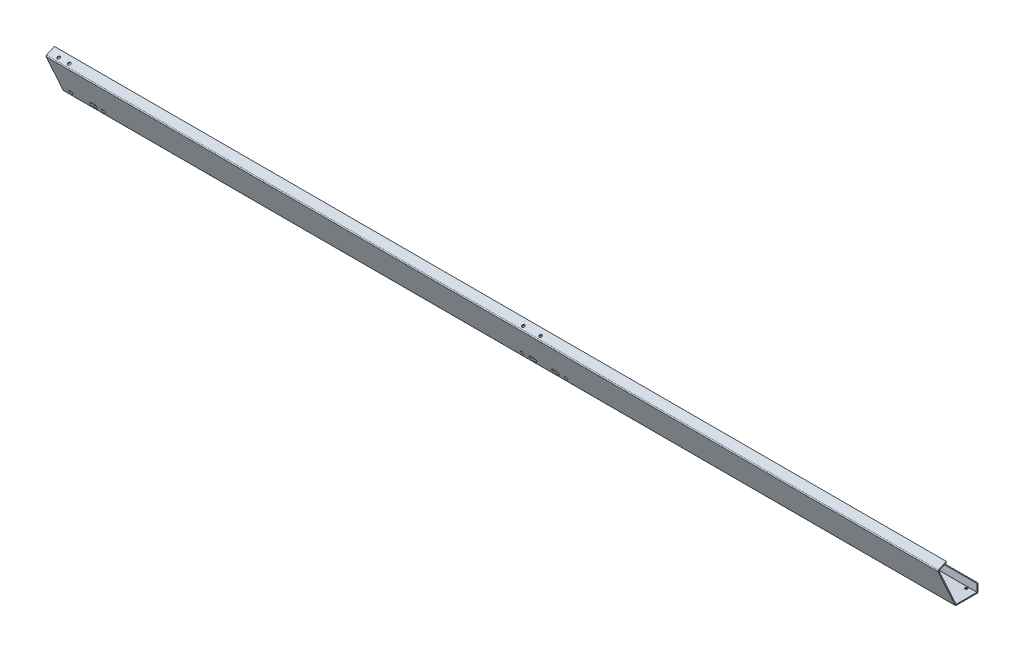
from build123d import *

# Parameters (mm, degrees)
SKETCH1_W                    = 4665
SKETCH1_H                    = 45
BASE_FLANGE1_DEPTH           = 5
EDGE_FLANGE1_STRIP_W         = 20.4
EDGE_FLANGE1_STRIP_H         = 5
EDGE_FLANGE1_STRIP_CUT_DEPTH = 4665
EDGE_FLANGE1_DEPTH           = 4665
EDGE_FLANGE2_START           = -2332.5
EDGE_FLANGE2_DEPTH           = 4665
EDGE_FLANGE2_2_DEPTH         = 4665
EDGE_FLANGE3_STRIP_W         = 20.4
EDGE_FLANGE3_STRIP_H         = 5
EDGE_FLANGE3_STRIP_CUT_DEPTH = 4665
EDGE_FLANGE3_DEPTH           = 4665
SKETCH15_R                   = 7
CUT_EXTRUDE1_DEPTH           = 10
SKETCH16_R                   = 7
CUT_EXTRUDE2_DEPTH           = 10
SKETCH17_R                   = 6.5
CUT_EXTRUDE3_DEPTH           = 10
LPATTERN1_COUNT              = 26
LPATTERN1_PITCH              = 178
SKETCH18_R                   = 9
CUT_EXTRUDE4_DEPTH           = 10


# Read off the part's stored shape, not the designer's step: Edge-Flange2
# Sheet-metal steps are written as plain solids
with BuildPart() as part:
    # Sketch1 → Base-Flange1 (new body)
    with BuildSketch(Plane.XY):
        Rectangle(SKETCH1_W, SKETCH1_H)
    extrude(amount=-BASE_FLANGE1_DEPTH)

    # Edge-Flange1 strip (across the edge) → Edge-Flange1 strip cut (cut)
    with BuildSketch(Plane(origin=(-2332.5, -22.5, 0), x_dir=(0, 1, 0), z_dir=(1, 0, 0))):
        with Locations((-5, -2.5)):
            Rectangle(EDGE_FLANGE1_STRIP_W, EDGE_FLANGE1_STRIP_H)
    extrude(amount=EDGE_FLANGE1_STRIP_CUT_DEPTH, mode=Mode.SUBTRACT)

    # Edge-Flange1 section (across the edge) → Edge-Flange1 (add)
    with BuildSketch(Plane(origin=(-2332.5, -22.5, 0), x_dir=(0, 1, 0), z_dir=(1, 0, 0))):
        with BuildLine():
            Line((0, 0.2), (0, 115))
            Line((0, 115), (5, 115))
            Line((5, 115), (5, 0.2))
            ThreePointArc((5, 0.2), (5.058578644, 0.058578644), (5.2, 0))
            Line((5.2, 0), (5.2, -5))
            ThreePointArc((5.2, -5), (1.523044738, -3.476955262), (0, 0.2))
        make_face()
    extrude(amount=EDGE_FLANGE1_DEPTH)

    # Edge-Flange2 outline → Edge-Flange2 (cut)
    with BuildSketch(Plane.YZ.offset(EDGE_FLANGE2_START)):
        with BuildLine():
            ThreePointArc((-22.5, 109.376616329), (-21.673402867, 112.18968358), (-19.456404862, 114.108414938))
            Line((-19.456404862, 114.108414938), (-17.5, 115))
            Line((-17.5, 115), (-22.5, 115))
            Line((-22.5, 115), (-22.5, 109.376616329))
        make_face()
    extrude(amount=EDGE_FLANGE2_DEPTH, mode=Mode.SUBTRACT)

    # Edge-Flange2 2 outline → Edge-Flange2 2 (add)
    with BuildSketch(Plane.YZ.offset(EDGE_FLANGE2_START)):
        with BuildLine():
            Line((182.241285947, 206.02734832), (-17.5, 115))
            Line((-17.5, 115), (-17.5, 109.376616329))
            ThreePointArc((-17.5, 109.376616329), (-17.468207803, 109.484811224), (-17.382938649, 109.558608584))
            Line((-17.382938649, 109.558608584), (184.314752161, 201.477541966))
            Line((184.314752161, 201.477541966), (182.241285947, 206.02734832))
        make_face()
    extrude(amount=EDGE_FLANGE2_2_DEPTH)

    # Edge-Flange3 strip (across the edge) → Edge-Flange3 strip cut (cut)
    with BuildSketch(Plane(origin=(-2332.5, 184.314752161, 201.477541966), x_dir=(0, -0.9099612708765384, -0.4146932426562495), z_dir=(1, 0, 0))):
        with Locations((-5, -2.5)):
            Rectangle(EDGE_FLANGE3_STRIP_W, EDGE_FLANGE3_STRIP_H)
    extrude(amount=EDGE_FLANGE3_STRIP_CUT_DEPTH, mode=Mode.SUBTRACT)

    # Edge-Flange3 section (across the edge) → Edge-Flange3 (add)
    with BuildSketch(Plane(origin=(-2332.5, 184.314752161, 201.477541966), x_dir=(0, -0.9099612708765384, -0.4146932426562495), z_dir=(1, 0, 0))):
        with BuildLine():
            Line((0, 0.2), (0, 45))
            Line((0, 45), (5, 45))
            Line((5, 45), (5, 0.2))
            ThreePointArc((5, 0.2), (5.058578644, 0.058578644), (5.2, 0))
            Line((5.2, 0), (5.2, -5))
            ThreePointArc((5.2, -5), (1.523044738, -3.476955262), (0, 0.2))
        make_face()
    extrude(amount=EDGE_FLANGE3_DEPTH)

    # Sketch15 → Cut-Extrude1 (cut)
    with BuildSketch(Plane(origin=(0, 228.646570306, 104.200245326), x_dir=(1, 0, 0), z_dir=(0, 0.9099612708765382, 0.4146932426562498))):
        with Locations(Location((-2282.5, -91.902677897, 0), (0, 0, 270))):
            Circle(SKETCH15_R)
        with Locations(Location((-2227.5, -91.902677897, 0), (0, 0, 270))):
            Circle(SKETCH15_R)
    extrude(amount=-CUT_EXTRUDE1_DEPTH, mode=Mode.SUBTRACT)

    # Sketch16 → Cut-Extrude2 (cut)
    with BuildSketch(Plane(origin=(0, 228.646570306, 104.200245326), x_dir=(1, 0, 0), z_dir=(0, 0.9099612708765383, 0.41469324265624985))):
        with Locations(Location((237.5, -91.902677897, 0), (0, 0, 270))):
            Circle(SKETCH16_R)
        with Locations(Location((147.5, -91.902677897, 0), (0, 0, 270))):
            Circle(SKETCH16_R)
    extrude(amount=-CUT_EXTRUDE2_DEPTH, mode=Mode.SUBTRACT)

    # Sketch17 → Cut-Extrude3 (cut)
    with BuildSketch(Plane.XZ.offset(22.5)):
        with Locations(Location((-2163.5, 10, 0), (0, 0, 270))):
            Circle(SKETCH17_R)
    cut_extrude3 = extrude(amount=-CUT_EXTRUDE3_DEPTH, mode=Mode.SUBTRACT)

    # LPattern1: Cut-Extrude3 ×26
    with Locations(*[(i * LPATTERN1_PITCH, 0, 0) for i in range(1, LPATTERN1_COUNT)]):
        add(cut_extrude3, mode=Mode.SUBTRACT)

    # Sketch18 → Cut-Extrude4 (cut)
    with BuildSketch(Plane(origin=(0, -46.405284359, 101.827102994), x_dir=(1, 0, 0), z_dir=(0, -0.4146932426562464, 0.90996127087654))):
        with Locations(Location((-2112.5, 52.249514406, 0), (0, 0, 270))):
            Circle(SKETCH18_R)
        with Locations(Location((-2282.5, 52.249514406, 0), (0, 0, 270))):
            Circle(SKETCH18_R)
        with Locations(Location((307.5, 52.249514406, 0), (0, 0, 270))):
            Circle(SKETCH18_R)
        with Locations(Location((77.5, 52.249514406, 0), (0, 0, 270))):
            Circle(SKETCH18_R)
        with BuildLine():
            Line((-2171.5, 40.249514406), (-2157.5, 40.249514406))
            ThreePointArc((-2157.5, 40.249514406), (-2145.5, 52.249514406), (-2157.5, 64.249514406))
            Line((-2157.5, 64.249514406), (-2171.5, 64.249514406))
            ThreePointArc((-2171.5, 64.249514406), (-2183.5, 52.249514406), (-2171.5, 40.249514406))
        make_face()
        with BuildLine():
            Line((126.5, 40.249514406), (140.5, 40.249514406))
            ThreePointArc((140.5, 40.249514406), (152.5, 52.249514406), (140.5, 64.249514406))
            Line((140.5, 64.249514406), (126.5, 64.249514406))
            ThreePointArc((126.5, 64.249514406), (114.5, 52.249514406), (126.5, 40.249514406))
        make_face()
        with BuildLine():
            Line((244.5, 40.249514406), (258.5, 40.249514406))
            ThreePointArc((258.5, 40.249514406), (270.5, 52.249514406), (258.5, 64.249514406))
            Line((258.5, 64.249514406), (244.5, 64.249514406))
            ThreePointArc((244.5, 64.249514406), (232.5, 52.249514406), (244.5, 40.249514406))
        make_face()
    extrude(amount=-CUT_EXTRUDE4_DEPTH, mode=Mode.SUBTRACT)


solid = part.part
